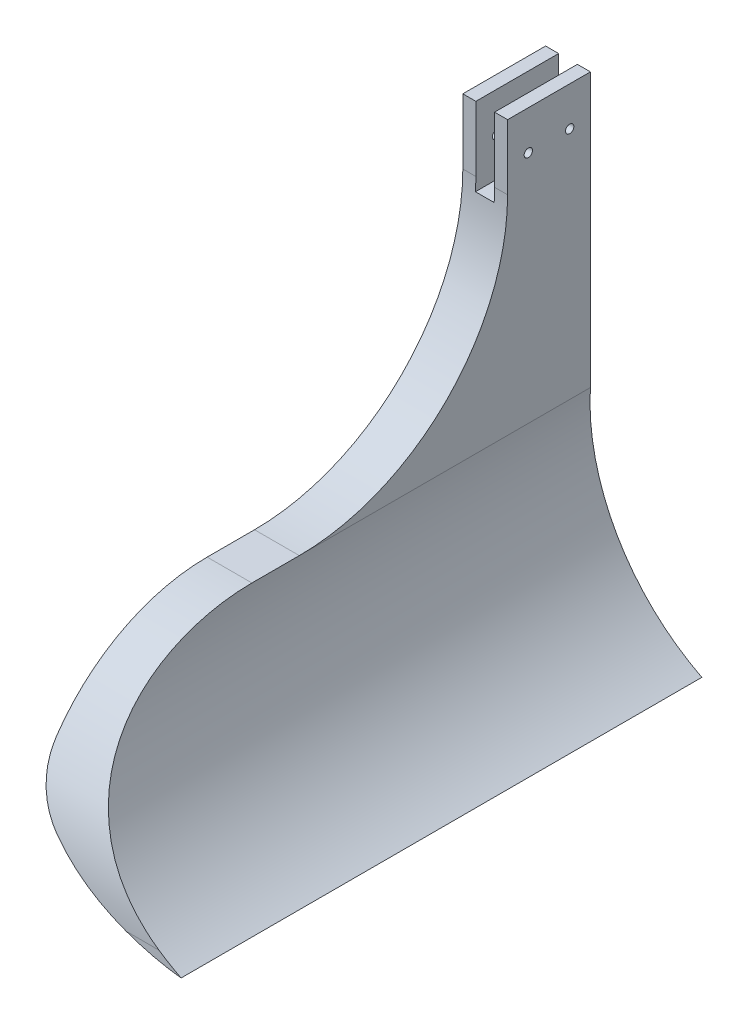
from build123d import *

# Parameters (mm, degrees)
RESSALTO_EXTRUS_O1_DEPTH = 31.8
RESSALTO_EXTRUS_O2_START = 31.8
RESSALTO_EXTRUS_O2_DEPTH = 168.2
FILETE1_R                = 80
FILETE2_R                = 30
FILETE3_R                = 70
ESBO_O2_R                = 1.6
CORTE_EXTRUS_O2_DEPTH    = 228.870577403


with BuildPart() as part:
    # Esboço1 → Ressalto-extrusão1 (new body)
    with BuildSketch(Plane.XY):
        Polygon((-17.8, 75), (-25, 75), (-25, 105), (-30, 105), (-30, 75), (-30, 0), (-12.8, 0), (-12.8, 75), (-12.8, 105), (-17.8, 105), align=None)
        with BuildLine():
            Line((-12.8, 0), (-30, 0))
            Line((-30, 0), (-30, -42.598518169))
            ThreePointArc((-30, -42.598518169), (-3.119977625, -64.576731192), (30, -75))
            ThreePointArc((30, -75), (-2.613275136, -43.899042345), (-12.8, 0))
        make_face()
    extrude(amount=RESSALTO_EXTRUS_O1_DEPTH)

    # Esboço1<4> → Ressalto-extrusão2 (add)
    with BuildSketch(Plane.XY.offset(RESSALTO_EXTRUS_O2_START)):
        with BuildLine():
            Line((-12.8, 0), (-30, 0))
            Line((-30, 0), (-30, -42.598518169))
            ThreePointArc((-30, -42.598518169), (-3.119977625, -64.576731192), (30, -75))
            ThreePointArc((30, -75), (-2.613275136, -43.899042345), (-12.8, 0))
        make_face()
    extrude(amount=RESSALTO_EXTRUS_O2_DEPTH)

    # Filete1
    # the kernel refuses this fillet: 80 mm, written as the material it adds along each edge
    with BuildSketch(Plane(origin=(-12.8, 0, 31.8), x_dir=(0, 0, 1), z_dir=(-1, 0, 0))) as filete1_piece_1_section:
        with BuildLine():
            CenterArc((FILETE1_R, FILETE1_R), FILETE1_R, 180, 90)
            Line((0, FILETE1_R), (0, 0))
            Line((0, 0), (FILETE1_R, 0))
        make_face()
    filete1_piece_1 = extrude(amount=17.2, mode=Mode.PRIVATE)
    filete1_piece_1 = filete1_piece_1 - Plane(origin=(65.698057665, -4.916041759, 49.992599302), x_dir=(-0.4538743908259289, -0.8910656751061574, 0), z_dir=(0, 0, -1)) * Cylinder(78.65184374, 355, mode=Mode.PRIVATE)
    filete1_piece_1 = split(filete1_piece_1, bisect_by=Plane(origin=(-15.301775564, 75, 49.992599302), z_dir=(0, -1, 0)), keep=Keep.TOP, mode=Mode.PRIVATE)
    filete1_piece_1 = split(filete1_piece_1, bisect_by=Plane(origin=(-17.8, 17.823232591, 49.992599302), z_dir=(1, 0, 0)), keep=Keep.TOP, mode=Mode.PRIVATE)
    add(filete1_piece_1)
    with BuildSketch(Plane(origin=(-12.8, 0, 31.8), x_dir=(0, 0, 1), z_dir=(-1, 0, 0))) as filete1_piece_2_section:
        with BuildLine():
            CenterArc((FILETE1_R, FILETE1_R), FILETE1_R, 180, 90)
            Line((0, FILETE1_R), (0, 0))
            Line((0, 0), (FILETE1_R, 0))
        make_face()
    filete1_piece_2 = extrude(amount=17.2, mode=Mode.PRIVATE)
    filete1_piece_2 = split(filete1_piece_2, bisect_by=Plane(origin=(-15.3, 75, 31.026714825), z_dir=(0, 1, 0)), keep=Keep.TOP, mode=Mode.PRIVATE)
    filete1_piece_2 = split(filete1_piece_2, bisect_by=Plane(origin=(-17.8, 77.46056258, 31.026714825), z_dir=(1, 0, 0)), keep=Keep.TOP, mode=Mode.PRIVATE)
    add(filete1_piece_2)
    with BuildSketch(Plane(origin=(-12.8, 0, 31.8), x_dir=(0, 0, 1), z_dir=(-1, 0, 0))) as filete1_piece_3_section:
        with BuildLine():
            CenterArc((FILETE1_R, FILETE1_R), FILETE1_R, 180, 90)
            Line((0, FILETE1_R), (0, 0))
            Line((0, 0), (FILETE1_R, 0))
        make_face()
    filete1_piece_3 = extrude(amount=17.2, mode=Mode.PRIVATE)
    filete1_piece_3 = split(filete1_piece_3, bisect_by=Plane(origin=(-25, 17.809681015, 50.007682963), z_dir=(1, 0, 0)), keep=Keep.TOP, mode=Mode.PRIVATE)
    filete1_piece_3 = split(filete1_piece_3, bisect_by=Plane(origin=(-21.4, 75, 50.007682963), z_dir=(0, -1, 0)), keep=Keep.TOP, mode=Mode.PRIVATE)
    filete1_piece_3 = split(filete1_piece_3, bisect_by=Plane(origin=(-17.8, 17.809681015, 50.007682963), z_dir=(-1, 0, 0)), keep=Keep.TOP, mode=Mode.PRIVATE)
    add(filete1_piece_3)
    with BuildSketch(Plane(origin=(-12.8, 0, 31.8), x_dir=(0, 0, 1), z_dir=(-1, 0, 0))) as filete1_piece_4_section:
        with BuildLine():
            CenterArc((FILETE1_R, FILETE1_R), FILETE1_R, 180, 90)
            Line((0, FILETE1_R), (0, 0))
            Line((0, 0), (FILETE1_R, 0))
        make_face()
    filete1_piece_4 = extrude(amount=17.2, mode=Mode.PRIVATE)
    filete1_piece_4 = split(filete1_piece_4, bisect_by=Plane(origin=(-25, 17.809681015, 50.007682963), z_dir=(-1, 0, 0)), keep=Keep.TOP, mode=Mode.PRIVATE)
    filete1_piece_4 = split(filete1_piece_4, bisect_by=Plane(origin=(-27.5, 75, 50.007682963), z_dir=(0, -1, 0)), keep=Keep.TOP, mode=Mode.PRIVATE)
    add(filete1_piece_4)
    with BuildSketch(Plane(origin=(-12.8, 0, 31.8), x_dir=(0, 0, 1), z_dir=(-1, 0, 0))) as filete1_piece_5_section:
        with BuildLine():
            CenterArc((FILETE1_R, FILETE1_R), FILETE1_R, 180, 90)
            Line((0, FILETE1_R), (0, 0))
            Line((0, 0), (FILETE1_R, 0))
        make_face()
    filete1_piece_5 = extrude(amount=17.2, mode=Mode.PRIVATE)
    filete1_piece_5 = split(filete1_piece_5, bisect_by=Plane(origin=(-25, 77.46056258, 31.026714825), z_dir=(-1, 0, 0)), keep=Keep.TOP, mode=Mode.PRIVATE)
    filete1_piece_5 = split(filete1_piece_5, bisect_by=Plane(origin=(-27.5, 75, 31.026714825), z_dir=(0, 1, 0)), keep=Keep.TOP, mode=Mode.PRIVATE)
    add(filete1_piece_5)

    # Filete2
    filete2_edges = [part.edges().sort_by_distance(p)[0] for p in [
        (-30, -42.598518169, 100),
    ]]
    fillet(filete2_edges, radius=FILETE2_R)

    # Filete3
    # the kernel refuses this fillet: 70 mm, written as the material it takes off along each edge
    with BuildSketch(Plane(origin=(162.2, 0, 200), x_dir=(0, -1, 0), z_dir=(-1, 0, 0))) as filete3_piece_1:
        with BuildLine():
            CenterArc((FILETE3_R, -FILETE3_R), FILETE3_R, 90, 90)
            Line((0, -FILETE3_R), (0, 0))
            Line((0, 0), (FILETE3_R, 0))
        make_face()
    extrude(amount=367.2, mode=Mode.SUBTRACT)

    # Esboço2 → Corte-extrusão2 (cut, through all)
    with BuildSketch(Plane(origin=(0, 0, 0), x_dir=(0, 0, -1), z_dir=(1, 0, 0))):
        with Locations((-23.85, 90)):
            Circle(ESBO_O2_R)
        with Locations((-7.95, 90)):
            Circle(ESBO_O2_R)
        Polygon((-187.539156299, -70), (-160.893258266, -56.677050983), (-160.893258266, -70), align=None)
        Polygon((-190.893258266, -68.322949017), (-164.247360232, -55), (-190.893258266, -55), align=None)
    extrude(amount=-CORTE_EXTRUS_O2_DEPTH, mode=Mode.SUBTRACT)


solid = part.part
